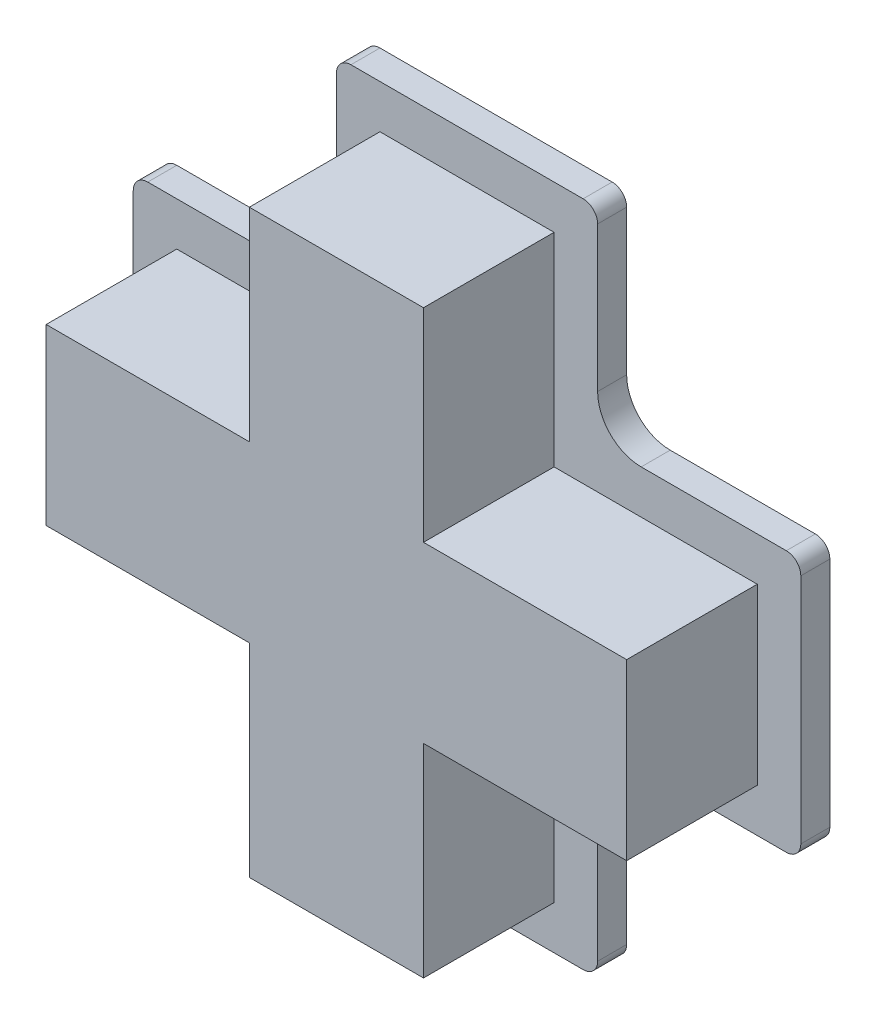
from build123d import *

# Parameters (mm, degrees)
BOSS_EXTRUDE1_DEPTH = 5.5
BOSS_EXTRUDE2_DEPTH = 1


with BuildPart() as part:
    # Sketch1 → Boss-Extrude1 (new body)
    with BuildSketch(Plane.XY):
        Polygon((-14.173922558, 7.032133424), (-14.173922558, 1.032133424), (-7.173922558, 1.032133424), (-7.173922558, -5.967866576), (-1.173922558, -5.967866576), (-1.173922558, 1.032133424), (5.826077442, 1.032133424), (5.826077442, 7.032133424), (-1.173922558, 7.032133424), (-1.173922558, 14.032133424), (-7.173922558, 14.032133424), (-7.173922558, 7.032133424), align=None)
    extrude(amount=BOSS_EXTRUDE1_DEPTH)

    # Sketch2 → Boss-Extrude2 (add)
    with BuildSketch(Plane.XY):
        with BuildLine():
            Line((-15.673922558, 8.032133424), (-15.673922558, 0.032133424))
            ThreePointArc((-15.673922558, 0.032133424), (-15.527475948, -0.321419967), (-15.173922558, -0.467866576))
            Line((-15.173922558, -0.467866576), (-10.173922558, -0.467866576))
            ThreePointArc((-10.173922558, -0.467866576), (-9.113262386, -0.907206404), (-8.673922558, -1.967866576))
            Line((-8.673922558, -1.967866576), (-8.673922558, -6.967866576))
            ThreePointArc((-8.673922558, -6.967866576), (-8.527475948, -7.321419967), (-8.173922558, -7.467866576))
            Line((-8.173922558, -7.467866576), (-0.173922558, -7.467866576))
            ThreePointArc((-0.173922558, -7.467866576), (0.179630833, -7.321419967), (0.326077442, -6.967866576))
            Line((0.326077442, -6.967866576), (0.326077442, -1.967866576))
            ThreePointArc((0.326077442, -1.967866576), (0.765417271, -0.907206404), (1.826077442, -0.467866576))
            Line((1.826077442, -0.467866576), (6.826077442, -0.467866576))
            ThreePointArc((6.826077442, -0.467866576), (7.179630833, -0.321419967), (7.326077442, 0.032133424))
            Line((7.326077442, 0.032133424), (7.326077442, 8.032133424))
            ThreePointArc((7.326077442, 8.032133424), (7.179630833, 8.385686814), (6.826077442, 8.532133424))
            Line((6.826077442, 8.532133424), (1.826077442, 8.532133424))
            ThreePointArc((1.826077442, 8.532133424), (0.765417271, 8.971473252), (0.326077442, 10.032133424))
            Line((0.326077442, 10.032133424), (0.326077442, 15.032133424))
            ThreePointArc((0.326077442, 15.032133424), (0.179630833, 15.385686814), (-0.173922558, 15.532133424))
            Line((-0.173922558, 15.532133424), (-8.173922558, 15.532133424))
            ThreePointArc((-8.173922558, 15.532133424), (-8.527475948, 15.385686814), (-8.673922558, 15.032133424))
            Line((-8.673922558, 15.032133424), (-8.673922558, 10.032133424))
            ThreePointArc((-8.673922558, 10.032133424), (-9.113262386, 8.971473252), (-10.173922558, 8.532133424))
            Line((-10.173922558, 8.532133424), (-15.173922558, 8.532133424))
            ThreePointArc((-15.173922558, 8.532133424), (-15.527475948, 8.385686814), (-15.673922558, 8.032133424))
        make_face()
    extrude(amount=BOSS_EXTRUDE2_DEPTH)


solid = part.part
